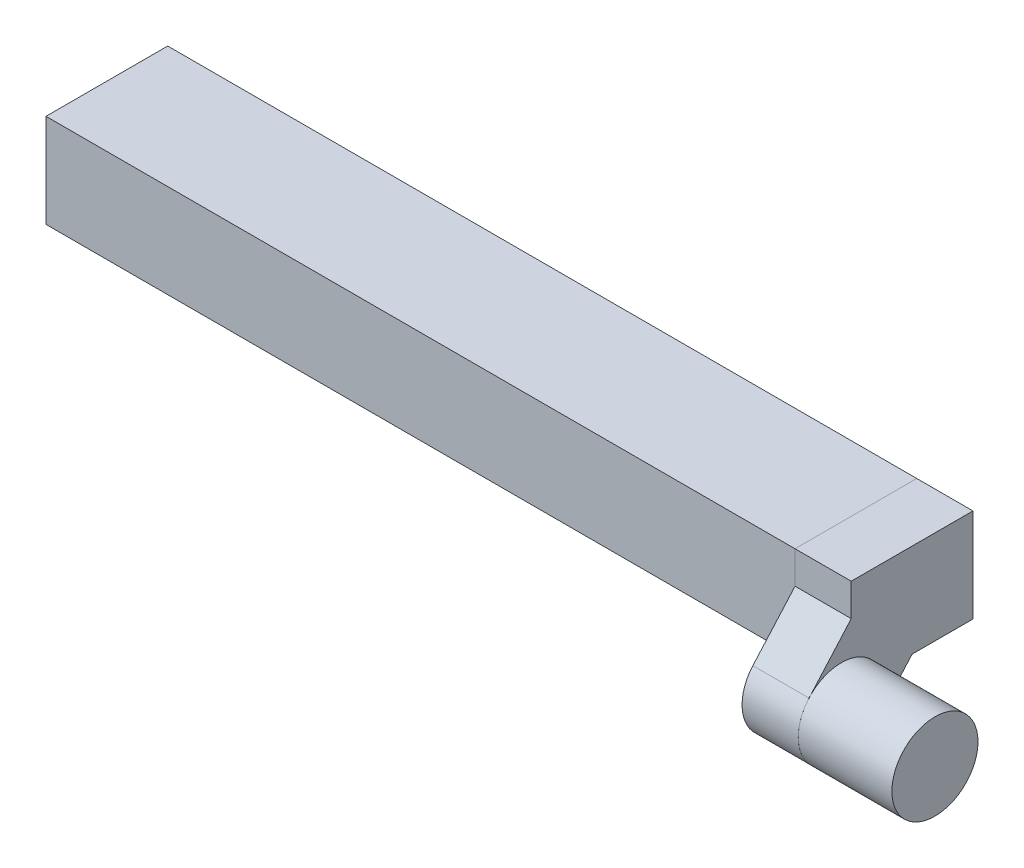
from build123d import *

# Parameters (mm, degrees)
SKETCH2_W           = 6.5
SKETCH2_H           = 5
SKETCH2_W_2         = 4.1
SKETCH2_H_2         = 4.1
BOSS_EXTRUDE1_DEPTH = 10
BOSS_EXTRUDE2_START = 15
SKETCH2_2_W         = 6.5
SKETCH2_2_H         = 5
BOSS_EXTRUDE2_DEPTH = 25
BOSS_EXTRUDE3_DEPTH = 3
SKETCH6_R           = 2.3
BOSS_EXTRUDE4_DEPTH = 5
BOSS_EXTRUDE5_START = 10
SKETCH2_4_W         = 6.5
SKETCH2_4_H         = 5
SKETCH2_4_W_2       = 4.1
SKETCH2_4_H_2       = 4.1
BOSS_EXTRUDE5_DEPTH = 5


with BuildPart() as part:
    # Sketch2 → Boss-Extrude1 (new body)
    with BuildSketch(Plane(origin=(0, 0, 0), x_dir=(0, 0, -1), z_dir=(1, 0, 0))):
        Rectangle(SKETCH2_W, SKETCH2_H)
        Rectangle(SKETCH2_W_2, SKETCH2_H_2, mode=Mode.SUBTRACT)
    extrude(amount=BOSS_EXTRUDE1_DEPTH)



with BuildPart() as body_2:
    # Sketch2<2> → Boss-Extrude2 (new body)
    with BuildSketch(Plane(origin=(0, 0, 0), x_dir=(0, 0, -1), z_dir=(1, 0, 0)).offset(BOSS_EXTRUDE2_START)):
        Rectangle(SKETCH2_2_W, SKETCH2_2_H)
    extrude(amount=BOSS_EXTRUDE2_DEPTH)


with BuildPart() as body_3:
    # Sketch5 → Boss-Extrude3 (new body)
    with BuildSketch(Plane(origin=(40, 0, 0), x_dir=(0, 0, -1), z_dir=(1, 0, 0))):
        with BuildLine():
            Line((-3.25, 2.5), (3.25, 2.5))
            Line((3.25, 2.5), (3.25, -2.5))
            Line((3.25, -2.5), (0, -2.5))
            Line((0, -2.5), (-2.057696457, -4.826685571))
            ThreePointArc((-2.057696457, -4.826685571), (-5.30428327, -5.02586906), (-5.50346676, -1.779282247))
            Line((-5.50346676, -1.779282247), (-3.25, 0.76876539))
            Line((-3.25, 0.76876539), (-3.25, 2.5))
        make_face()
    extrude(amount=BOSS_EXTRUDE3_DEPTH)


with BuildPart() as body_4:
    # Sketch6 → Boss-Extrude4 (new body)
    with BuildSketch(Plane(origin=(43, 0, 0), x_dir=(0, 0, -1), z_dir=(1, 0, 0))):
        with Locations((-3.780581608, -3.302983909)):
            Circle(SKETCH6_R)
    extrude(amount=BOSS_EXTRUDE4_DEPTH)


with BuildPart() as part_1:
    add(part.part)

    add(body_2.part)  # Boss-Extrude5 merges body 2
    # Sketch2<4> → Boss-Extrude5 (add)
    with BuildSketch(Plane(origin=(0, 0, 0), x_dir=(0, 0, -1), z_dir=(1, 0, 0)).offset(BOSS_EXTRUDE5_START)):
        Rectangle(SKETCH2_4_W, SKETCH2_4_H)
        Rectangle(SKETCH2_4_W_2, SKETCH2_4_H_2, mode=Mode.SUBTRACT)
    extrude(amount=BOSS_EXTRUDE5_DEPTH)


solid = Compound([body_3.part, body_4.part, part_1.part])
